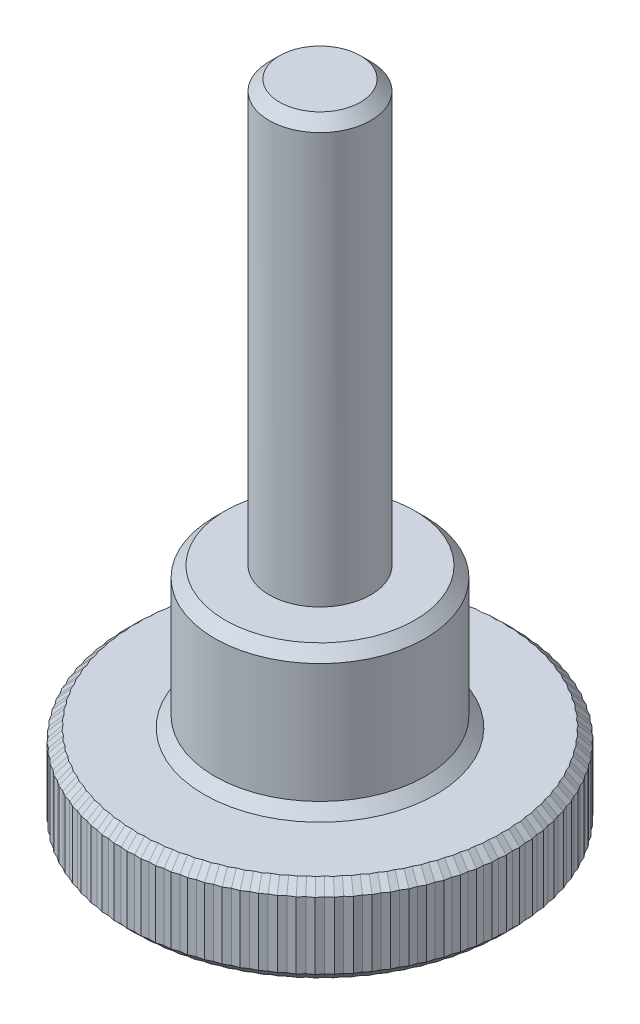
from build123d import *

# Parameters (mm, degrees)
EXTRUDE1_DEPTH = 2.5
SKETCH2_R      = 3
EXTRUDE2_DEPTH = 4
SKETCH3_R      = 1.45
EXTRUDE3_DEPTH = 12
CHAMFER1_SIZE  = 0.3


with BuildPart() as part:
    # Sketch1 → Extrude1 (new body)
    with BuildSketch(Plane(origin=(0, 0, 0), x_dir=(1, 0, 0), z_dir=(0, 1, 0))):
        Polygon((0.191123412, 5.473058443), (0, 5.5), (-0.191123412, 5.473058443), (-0.383660606, 5.486602276), (-0.572439103, 5.446394252), (-0.765452055, 5.446474378), (-0.950965928, 5.393195776), (-1.143514299, 5.379811804), (-1.324859742, 5.313722192), (-1.516005457, 5.286939328), (-1.692298973, 5.208360688), (-1.881110788, 5.168309414), (-2.051493493, 5.077624575), (-2.237051537, 5.024500017), (-2.400693343, 4.922150784), (-2.582093595, 4.856211761), (-2.738197257, 4.74269677), (-2.914555953, 4.664264529), (-3.062360949, 4.540136814), (-3.232818888, 4.449593469), (-3.371605126, 4.315457768), (-3.535331853, 4.213244437), (-3.664423182, 4.069754245), (-3.820621038, 3.956368902), (-3.939388536, 3.804223289), (-4.08729654, 3.680218335), (-4.195161586, 3.520158539), (-4.334059145, 3.386138114), (-4.43049623, 3.218943931), (-4.559706649, 3.075560969), (-4.644245942, 2.902046952), (-4.763139721, 2.75), (-4.835369354, 2.571011491), (-4.943367255, 2.411041307), (-5.002935333, 2.227450321), (-5.0995112, 2.060336264), (-5.146127513, 1.873037237), (-5.23081084, 1.699593469), (-5.264248278, 1.509498903), (-5.336626495, 1.330570426), (-5.356722155, 1.138606443), (-5.416442642, 0.955064977), (-5.423098619, 0.762166807), (-5.469870425, 0.574906548), (-5.463054292, 0.38201397), (-5.496649549, 0.191947232), (-5.476394514, 0), (-5.496649549, -0.191947232), (-5.463054292, -0.38201397), (-5.469870425, -0.574906548), (-5.423098619, -0.762166807), (-5.416442642, -0.955064977), (-5.356722155, -1.138606443), (-5.336626495, -1.330570426), (-5.264248278, -1.509498903), (-5.23081084, -1.699593469), (-5.146127513, -1.873037237), (-5.0995112, -2.060336264), (-5.002935333, -2.227450321), (-4.943367255, -2.411041307), (-4.835369354, -2.571011491), (-4.763139721, -2.75), (-4.644245942, -2.902046952), (-4.559706649, -3.075560969), (-4.43049623, -3.218943931), (-4.334059145, -3.386138114), (-4.195161586, -3.520158539), (-4.08729654, -3.680218335), (-3.939388536, -3.804223289), (-3.820621038, -3.956368902), (-3.664423182, -4.069754245), (-3.535331853, -4.213244437), (-3.371605126, -4.315457768), (-3.232818888, -4.449593469), (-3.062360949, -4.540136814), (-2.914555953, -4.664264529), (-2.738197257, -4.74269677), (-2.582093595, -4.856211761), (-2.400693343, -4.922150784), (-2.237051537, -5.024500017), (-2.051493493, -5.077624575), (-1.881110788, -5.168309414), (-1.692298973, -5.208360688), (-1.516005457, -5.286939328), (-1.324859742, -5.313722192), (-1.143514299, -5.379811804), (-0.950965928, -5.393195776), (-0.765452055, -5.446474378), (-0.572439103, -5.446394252), (-0.383660606, -5.486602276), (-0.191123412, -5.473058443), (0, -5.5), (0.191123412, -5.473058443), (0.383660606, -5.486602276), (0.572439103, -5.446394252), (0.765452055, -5.446474378), (0.950965928, -5.393195776), (1.143514299, -5.379811804), (1.324859742, -5.313722192), (1.516005457, -5.286939328), (1.692298973, -5.208360688), (1.881110788, -5.168309414), (2.051493493, -5.077624575), (2.237051537, -5.024500017), (2.400693343, -4.922150784), (2.582093595, -4.856211761), (2.738197257, -4.74269677), (2.914555953, -4.664264529), (3.062360949, -4.540136814), (3.232818888, -4.449593469), (3.371605126, -4.315457768), (3.535331853, -4.213244437), (3.664423182, -4.069754245), (3.820621038, -3.956368902), (3.939388536, -3.804223289), (4.08729654, -3.680218335), (4.195161586, -3.520158539), (4.334059145, -3.386138114), (4.43049623, -3.218943931), (4.559706649, -3.075560969), (4.644245942, -2.902046952), (4.763139721, -2.75), (4.835369354, -2.571011491), (4.943367255, -2.411041307), (5.002935333, -2.227450321), (5.0995112, -2.060336264), (5.146127513, -1.873037237), (5.23081084, -1.699593469), (5.264248278, -1.509498903), (5.336626495, -1.330570426), (5.356722155, -1.138606443), (5.416442642, -0.955064977), (5.423098619, -0.762166807), (5.469870425, -0.574906548), (5.463054292, -0.38201397), (5.496649549, -0.191947232), (5.476394514, 0), (5.496649549, 0.191947232), (5.463054292, 0.38201397), (5.469870425, 0.574906548), (5.423098619, 0.762166807), (5.416442642, 0.955064977), (5.356722155, 1.138606443), (5.336626495, 1.330570426), (5.264248278, 1.509498903), (5.23081084, 1.699593469), (5.146127513, 1.873037237), (5.0995112, 2.060336264), (5.002935333, 2.227450321), (4.943367255, 2.411041307), (4.835369354, 2.571011491), (4.763139721, 2.75), (4.644245942, 2.902046952), (4.559706649, 3.075560969), (4.43049623, 3.218943931), (4.334059145, 3.386138114), (4.195161586, 3.520158539), (4.08729654, 3.680218335), (3.939388536, 3.804223289), (3.820621038, 3.956368902), (3.664423182, 4.069754245), (3.535331853, 4.213244437), (3.371605126, 4.315457768), (3.232818888, 4.449593469), (3.062360949, 4.540136814), (2.914555953, 4.664264529), (2.738197257, 4.74269677), (2.582093595, 4.856211761), (2.400693343, 4.922150784), (2.237051537, 5.024500017), (2.051493493, 5.077624575), (1.881110788, 5.168309414), (1.692298973, 5.208360688), (1.516005457, 5.286939328), (1.324859742, 5.313722192), (1.143514299, 5.379811804), (0.950965928, 5.393195776), (0.765452055, 5.446474378), (0.572439103, 5.446394252), (0.383660606, 5.486602276), align=None)
    extrude(amount=EXTRUDE1_DEPTH)

    # Sketch2 → Extrude2 (add)
    with BuildSketch(Plane(origin=(0, 2.5, 0), x_dir=(1, 0, 0), z_dir=(0, 1, 0))):
        Circle(SKETCH2_R)
    extrude(amount=EXTRUDE2_DEPTH)

    # Sketch3 → Extrude3 (add)
    with BuildSketch(Plane(origin=(0, 6.5, 0), x_dir=(1, 0, 0), z_dir=(0, 1, 0))):
        Circle(SKETCH3_R)
    extrude(amount=EXTRUDE3_DEPTH)

    # Chamfer1
    chamfer1_edges = [part.edges().sort_by_distance(p)[0] for p in [
        (0.287392009, 2.5, -5.479830359),
        (0.478049854, 2.5, -5.466498264),
        (0.668945579, 2.5, -5.446434315),
        (0.858208991, 2.5, -5.419835077),
        (1.047240114, 2.5, -5.38650379),
        (1.234187021, 2.5, -5.346766998),
        (1.420432599, 2.5, -5.30033076),
        (1.604152215, 2.5, -5.247650008),
        (1.786704881, 2.5, -5.188335051),
        (1.966302141, 2.5, -5.122966995),
        (2.144272515, 2.5, -5.051062296),
        (2.31887244, 2.5, -4.973325401),
        (2.491393469, 2.5, -4.889181273),
        (2.660145426, 2.5, -4.799454266),
        (2.826376605, 2.5, -4.70348065),
        (2.988458451, 2.5, -4.602200672),
        (3.147589918, 2.5, -4.494865142),
        (3.302212007, 2.5, -4.382525619),
        (3.45346849, 2.5, -4.264351103),
        (3.599877518, 2.5, -4.141499341),
        (3.74252211, 2.5, -4.013061574),
        (3.880004787, 2.5, -3.880296096),
        (4.013342538, 2.5, -3.742220812),
        (4.141229063, 2.5, -3.600188437),
        (4.264610365, 2.5, -3.453148327),
        (4.382277687, 2.5, -3.302541023),
        (4.495101439, 2.5, -3.14725245),
        (4.601976295, 2.5, -2.98880396),
        (4.703692831, 2.5, -2.826023476),
        (4.799254537, 2.5, -2.660505745),
        (4.889368304, 2.5, -2.491026399),
        (4.973151294, 2.5, -2.319245814),
        (5.051223266, 2.5, -2.143893292),
        (5.122819357, 2.5, -1.96668675),
        (5.188469177, 2.5, -1.786315353),
        (5.247529559, 2.5, -1.604546186),
        (5.300437386, 2.5, -1.420034665),
        (5.346674325, 2.5, -1.234588434),
        (5.386582398, 2.5, -1.04683571),
        (5.41977063, 2.5, -0.858615892),
        (5.446484522, 2.5, -0.668536677),
        (5.466462358, 2.5, -0.478460259),
        (5.47985192, 2.5, -0.286980601),
        (5.486522031, 2.5, -0.095973616),
        (5.486522031, 2.5, 0.095973616),
        (5.47985192, 2.5, 0.286980601),
        (5.466462358, 2.5, 0.478460259),
        (5.446484522, 2.5, 0.668536677),
        (5.41977063, 2.5, 0.858615892),
        (5.386582398, 2.5, 1.04683571),
        (5.346674325, 2.5, 1.234588434),
        (5.300437386, 2.5, 1.420034665),
        (5.247529559, 2.5, 1.604546186),
        (5.188469177, 2.5, 1.786315353),
        (5.122819357, 2.5, 1.96668675),
        (5.051223266, 2.5, 2.143893292),
        (4.973151294, 2.5, 2.319245814),
        (4.889368304, 2.5, 2.491026399),
        (4.799254537, 2.5, 2.660505745),
        (4.703692831, 2.5, 2.826023476),
        (4.601976295, 2.5, 2.98880396),
        (4.495101439, 2.5, 3.14725245),
        (4.382277687, 2.5, 3.302541023),
        (4.264610365, 2.5, 3.453148327),
        (4.141229063, 2.5, 3.600188437),
        (4.013342538, 2.5, 3.742220812),
        (3.880004787, 2.5, 3.880296096),
        (3.74252211, 2.5, 4.013061574),
        (3.599877518, 2.5, 4.141499341),
        (3.45346849, 2.5, 4.264351103),
        (3.302212007, 2.5, 4.382525619),
        (3.147589918, 2.5, 4.494865142),
        (2.988458451, 2.5, 4.602200672),
        (2.826376605, 2.5, 4.70348065),
        (2.660145426, 2.5, 4.799454266),
        (2.491393469, 2.5, 4.889181273),
        (2.31887244, 2.5, 4.973325401),
        (2.144272515, 2.5, 5.051062296),
        (1.966302141, 2.5, 5.122966995),
        (1.786704881, 2.5, 5.188335051),
        (1.604152215, 2.5, 5.247650008),
        (1.420432599, 2.5, 5.30033076),
        (1.234187021, 2.5, 5.346766998),
        (1.047240114, 2.5, 5.38650379),
        (0.858208991, 2.5, 5.419835077),
        (0.668945579, 2.5, 5.446434315),
        (0.478049854, 2.5, 5.466498264),
        (0.287392009, 2.5, 5.479830359),
        (0.095561706, 2.5, 5.486529221),
        (-0.095561706, 2.5, 5.486529221),
        (-0.287392009, 2.5, 5.479830359),
        (-0.478049854, 2.5, 5.466498264),
        (-0.668945579, 2.5, 5.446434315),
        (-0.858208991, 2.5, 5.419835077),
        (-1.047240114, 2.5, 5.38650379),
        (-1.234187021, 2.5, 5.346766998),
        (-1.420432599, 2.5, 5.30033076),
        (-1.604152215, 2.5, 5.247650008),
        (-1.786704881, 2.5, 5.188335051),
        (-1.966302141, 2.5, 5.122966995),
        (-2.144272515, 2.5, 5.051062296),
        (-2.31887244, 2.5, 4.973325401),
        (-2.491393469, 2.5, 4.889181273),
        (-2.660145426, 2.5, 4.799454266),
        (-2.826376605, 2.5, 4.70348065),
        (-2.988458451, 2.5, 4.602200672),
        (-3.147589918, 2.5, 4.494865142),
        (-3.302212007, 2.5, 4.382525619),
        (-3.45346849, 2.5, 4.264351103),
        (-3.599877518, 2.5, 4.141499341),
        (-3.74252211, 2.5, 4.013061574),
        (-3.880004787, 2.5, 3.880296096),
        (-4.013342538, 2.5, 3.742220812),
        (-4.141229063, 2.5, 3.600188437),
        (-4.264610365, 2.5, 3.453148327),
        (-4.382277687, 2.5, 3.302541023),
        (-4.495101439, 2.5, 3.14725245),
        (-4.601976295, 2.5, 2.98880396),
        (-4.703692831, 2.5, 2.826023476),
        (-4.799254537, 2.5, 2.660505745),
        (-4.889368304, 2.5, 2.491026399),
        (-4.973151294, 2.5, 2.319245814),
        (-5.051223266, 2.5, 2.143893292),
        (-5.122819357, 2.5, 1.96668675),
        (-5.188469177, 2.5, 1.786315353),
        (-5.247529559, 2.5, 1.604546186),
        (-5.300437386, 2.5, 1.420034665),
        (-5.346674325, 2.5, 1.234588434),
        (-5.386582398, 2.5, 1.04683571),
        (-5.41977063, 2.5, 0.858615892),
        (-5.446484522, 2.5, 0.668536677),
        (-5.466462358, 2.5, 0.478460259),
        (-5.47985192, 2.5, 0.286980601),
        (-5.486522031, 2.5, 0.095973616),
        (-5.486522031, 2.5, -0.095973616),
        (-5.47985192, 2.5, -0.286980601),
        (-5.466462358, 2.5, -0.478460259),
        (-5.446484522, 2.5, -0.668536677),
        (-5.41977063, 2.5, -0.858615892),
        (-5.386582398, 2.5, -1.04683571),
        (-5.346674325, 2.5, -1.234588434),
        (-5.300437386, 2.5, -1.420034665),
        (-5.247529559, 2.5, -1.604546186),
        (-5.188469177, 2.5, -1.786315353),
        (-5.122819357, 2.5, -1.96668675),
        (-5.051223266, 2.5, -2.143893292),
        (-4.973151294, 2.5, -2.319245814),
        (-4.889368304, 2.5, -2.491026399),
        (-4.799254537, 2.5, -2.660505745),
        (-4.703692831, 2.5, -2.826023476),
        (-4.601976295, 2.5, -2.98880396),
        (-4.495101439, 2.5, -3.14725245),
        (-4.382277687, 2.5, -3.302541023),
        (-4.264610365, 2.5, -3.453148327),
        (-4.141229063, 2.5, -3.600188437),
        (-4.013342538, 2.5, -3.742220812),
        (-3.880004787, 2.5, -3.880296096),
        (-3.74252211, 2.5, -4.013061574),
        (-3.599877518, 2.5, -4.141499341),
        (-3.45346849, 2.5, -4.264351103),
        (-3.302212007, 2.5, -4.382525619),
        (-3.147589918, 2.5, -4.494865142),
        (-2.988458451, 2.5, -4.602200672),
        (-2.826376605, 2.5, -4.70348065),
        (-2.660145426, 2.5, -4.799454266),
        (-2.491393469, 2.5, -4.889181273),
        (-2.31887244, 2.5, -4.973325401),
        (-2.144272515, 2.5, -5.051062296),
        (-1.966302141, 2.5, -5.122966995),
        (-1.786704881, 2.5, -5.188335051),
        (-1.604152215, 2.5, -5.247650008),
        (-1.420432599, 2.5, -5.30033076),
        (-1.234187021, 2.5, -5.346766998),
        (-1.047240114, 2.5, -5.38650379),
        (-0.858208991, 2.5, -5.419835077),
        (-0.668945579, 2.5, -5.446434315),
        (-0.478049854, 2.5, -5.466498264),
        (-0.287392009, 2.5, -5.479830359),
        (-0.095561706, 2.5, -5.486529221),
        (0.095561706, 2.5, -5.486529221),
        (-3, 2.5, 0),
        (-0.095561706, 0, -5.486529221),
        (-0.287392009, 0, -5.479830359),
        (-0.478049854, 0, -5.466498264),
        (-0.668945579, 0, -5.446434315),
        (-0.858208991, 0, -5.419835077),
        (-1.047240114, 0, -5.38650379),
        (-1.234187021, 0, -5.346766998),
        (-1.420432599, 0, -5.30033076),
        (-1.604152215, 0, -5.247650008),
        (-1.786704881, 0, -5.188335051),
        (-1.966302141, 0, -5.122966995),
        (-2.144272515, 0, -5.051062296),
        (-2.31887244, 0, -4.973325401),
        (-2.491393469, 0, -4.889181273),
        (-2.660145426, 0, -4.799454266),
        (-2.826376605, 0, -4.70348065),
        (-2.988458451, 0, -4.602200672),
        (-3.147589918, 0, -4.494865142),
        (-3.302212007, 0, -4.382525619),
        (-3.45346849, 0, -4.264351103),
        (-3.599877518, 0, -4.141499341),
        (-3.74252211, 0, -4.013061574),
        (-3.880004787, 0, -3.880296096),
        (-4.013342538, 0, -3.742220812),
        (-4.141229063, 0, -3.600188437),
        (-4.264610365, 0, -3.453148327),
        (-4.382277687, 0, -3.302541023),
        (-4.495101439, 0, -3.14725245),
        (-4.601976295, 0, -2.98880396),
        (-4.703692831, 0, -2.826023476),
        (-4.799254537, 0, -2.660505745),
        (-4.889368304, 0, -2.491026399),
        (-4.973151294, 0, -2.319245814),
        (-5.051223266, 0, -2.143893292),
        (-5.122819357, 0, -1.96668675),
        (-5.188469177, 0, -1.786315353),
        (-5.247529559, 0, -1.604546186),
        (-5.300437386, 0, -1.420034665),
        (-5.346674325, 0, -1.234588434),
        (-5.386582398, 0, -1.04683571),
        (-5.41977063, 0, -0.858615892),
        (-5.446484522, 0, -0.668536677),
        (-5.466462358, 0, -0.478460259),
        (-5.47985192, 0, -0.286980601),
        (-5.486522031, 0, -0.095973616),
        (-5.486522031, 0, 0.095973616),
        (-5.47985192, 0, 0.286980601),
        (-5.466462358, 0, 0.478460259),
        (-5.446484522, 0, 0.668536677),
        (-5.41977063, 0, 0.858615892),
        (-5.386582398, 0, 1.04683571),
        (-5.346674325, 0, 1.234588434),
        (-5.300437386, 0, 1.420034665),
        (-5.247529559, 0, 1.604546186),
        (-5.188469177, 0, 1.786315353),
        (-5.122819357, 0, 1.96668675),
        (-5.051223266, 0, 2.143893292),
        (-4.973151294, 0, 2.319245814),
        (-4.889368304, 0, 2.491026399),
        (-4.799254537, 0, 2.660505745),
        (-4.703692831, 0, 2.826023476),
        (-4.601976295, 0, 2.98880396),
        (-4.495101439, 0, 3.14725245),
        (-4.382277687, 0, 3.302541023),
        (-4.264610365, 0, 3.453148327),
        (-4.141229063, 0, 3.600188437),
        (-4.013342538, 0, 3.742220812),
        (-3.880004787, 0, 3.880296096),
        (-3.74252211, 0, 4.013061574),
        (-3.599877518, 0, 4.141499341),
        (-3.45346849, 0, 4.264351103),
        (-3.302212007, 0, 4.382525619),
        (-3.147589918, 0, 4.494865142),
        (-2.988458451, 0, 4.602200672),
        (-2.826376605, 0, 4.70348065),
        (-2.660145426, 0, 4.799454266),
        (-2.491393469, 0, 4.889181273),
        (-2.31887244, 0, 4.973325401),
        (-2.144272515, 0, 5.051062296),
        (-1.966302141, 0, 5.122966995),
        (-1.786704881, 0, 5.188335051),
        (-1.604152215, 0, 5.247650008),
        (-1.420432599, 0, 5.30033076),
        (-1.234187021, 0, 5.346766998),
        (-1.047240114, 0, 5.38650379),
        (-0.858208991, 0, 5.419835077),
        (-0.668945579, 0, 5.446434315),
        (-0.478049854, 0, 5.466498264),
        (-0.287392009, 0, 5.479830359),
        (-0.095561706, 0, 5.486529221),
        (0.095561706, 0, 5.486529221),
        (0.287392009, 0, 5.479830359),
        (0.478049854, 0, 5.466498264),
        (0.668945579, 0, 5.446434315),
        (0.858208991, 0, 5.419835077),
        (1.047240114, 0, 5.38650379),
        (1.234187021, 0, 5.346766998),
        (1.420432599, 0, 5.30033076),
        (1.604152215, 0, 5.247650008),
        (1.786704881, 0, 5.188335051),
        (1.966302141, 0, 5.122966995),
        (2.144272515, 0, 5.051062296),
        (2.31887244, 0, 4.973325401),
        (2.491393469, 0, 4.889181273),
        (2.660145426, 0, 4.799454266),
        (2.826376605, 0, 4.70348065),
        (2.988458451, 0, 4.602200672),
        (3.147589918, 0, 4.494865142),
        (3.302212007, 0, 4.382525619),
        (3.45346849, 0, 4.264351103),
        (3.599877518, 0, 4.141499341),
        (3.74252211, 0, 4.013061574),
        (3.880004787, 0, 3.880296096),
        (4.013342538, 0, 3.742220812),
        (4.141229063, 0, 3.600188437),
        (4.264610365, 0, 3.453148327),
        (4.382277687, 0, 3.302541023),
        (4.495101439, 0, 3.14725245),
        (4.601976295, 0, 2.98880396),
        (4.703692831, 0, 2.826023476),
        (4.799254537, 0, 2.660505745),
        (4.889368304, 0, 2.491026399),
        (4.973151294, 0, 2.319245814),
        (5.051223266, 0, 2.143893292),
        (5.122819357, 0, 1.96668675),
        (5.188469177, 0, 1.786315353),
        (5.247529559, 0, 1.604546186),
        (5.300437386, 0, 1.420034665),
        (5.346674325, 0, 1.234588434),
        (5.386582398, 0, 1.04683571),
        (5.41977063, 0, 0.858615892),
        (5.446484522, 0, 0.668536677),
        (5.466462358, 0, 0.478460259),
        (5.47985192, 0, 0.286980601),
        (5.486522031, 0, 0.095973616),
        (5.486522031, 0, -0.095973616),
        (5.47985192, 0, -0.286980601),
        (5.466462358, 0, -0.478460259),
        (5.446484522, 0, -0.668536677),
        (5.41977063, 0, -0.858615892),
        (5.386582398, 0, -1.04683571),
        (5.346674325, 0, -1.234588434),
        (5.300437386, 0, -1.420034665),
        (5.247529559, 0, -1.604546186),
        (5.188469177, 0, -1.786315353),
        (5.122819357, 0, -1.96668675),
        (5.051223266, 0, -2.143893292),
        (4.973151294, 0, -2.319245814),
        (4.889368304, 0, -2.491026399),
        (4.799254537, 0, -2.660505745),
        (4.703692831, 0, -2.826023476),
        (4.601976295, 0, -2.98880396),
        (4.495101439, 0, -3.14725245),
        (4.382277687, 0, -3.302541023),
        (4.264610365, 0, -3.453148327),
        (4.141229063, 0, -3.600188437),
        (4.013342538, 0, -3.742220812),
        (3.880004787, 0, -3.880296096),
        (3.74252211, 0, -4.013061574),
        (3.599877518, 0, -4.141499341),
        (3.45346849, 0, -4.264351103),
        (3.302212007, 0, -4.382525619),
        (3.147589918, 0, -4.494865142),
        (2.988458451, 0, -4.602200672),
        (2.826376605, 0, -4.70348065),
        (2.660145426, 0, -4.799454266),
        (2.491393469, 0, -4.889181273),
        (2.31887244, 0, -4.973325401),
        (2.144272515, 0, -5.051062296),
        (1.966302141, 0, -5.122966995),
        (1.786704881, 0, -5.188335051),
        (1.604152215, 0, -5.247650008),
        (1.420432599, 0, -5.30033076),
        (1.234187021, 0, -5.346766998),
        (1.047240114, 0, -5.38650379),
        (0.858208991, 0, -5.419835077),
        (0.668945579, 0, -5.446434315),
        (0.478049854, 0, -5.466498264),
        (0.287392009, 0, -5.479830359),
        (0.095561706, 0, -5.486529221),
        (-1.45, 18.5, 0),
        (-3, 6.5, 0),
    ]]
    chamfer(chamfer1_edges, length=CHAMFER1_SIZE)


solid = part.part
